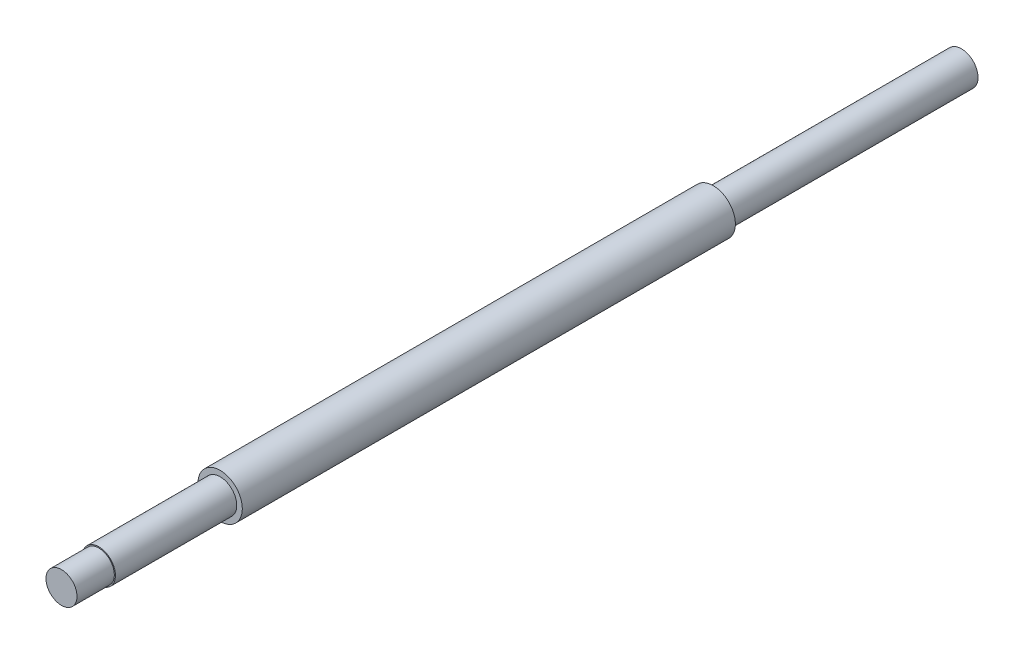
from build123d import *

# Parameters (mm, degrees)
SKETCH1_R           = 6.35
BOSS_EXTRUDE1_DEPTH = 141.2875
SKETCH2_R           = 4.7625
BOSS_EXTRUDE2_DEPTH = 45.466
BOSS_EXTRUDE3_START = 71.12
SKETCH3_R           = 4.7625
BOSS_EXTRUDE3_DEPTH = 71.12
SKETCH4_W           = 0.3175
SKETCH4_H           = 10.69975


with BuildPart() as part:
    # Sketch1 → Boss-Extrude1 (new body)
    with BuildSketch(Plane.XY):
        Circle(SKETCH1_R)
    extrude(amount=BOSS_EXTRUDE1_DEPTH)

    # Sketch2 → Boss-Extrude2 (add)
    with BuildSketch(Plane.XY.offset(141.2875)):
        Circle(SKETCH2_R)
    extrude(amount=BOSS_EXTRUDE2_DEPTH)

    # Sketch3 → Boss-Extrude3 (add)
    with BuildSketch(Plane(origin=(0, 0, 0), x_dir=(-1, 0, 0), z_dir=(0, 0, -1)).offset(BOSS_EXTRUDE3_START)):
        Circle(SKETCH3_R)
    extrude(amount=-BOSS_EXTRUDE3_DEPTH)

    # Sketch4 → Cut-Revolve1 (revolve, cut)
    with BuildSketch(Plane(origin=(0, 0, 0), x_dir=(1, 0, 0), z_dir=(0, 1, 0))):
        with Locations((4.60375, -181.403625)):
            Rectangle(SKETCH4_W, SKETCH4_H)
    revolve(axis=Axis((0, 0, 186.7535), (0, 0, -1)), mode=Mode.SUBTRACT)


solid = part.part
